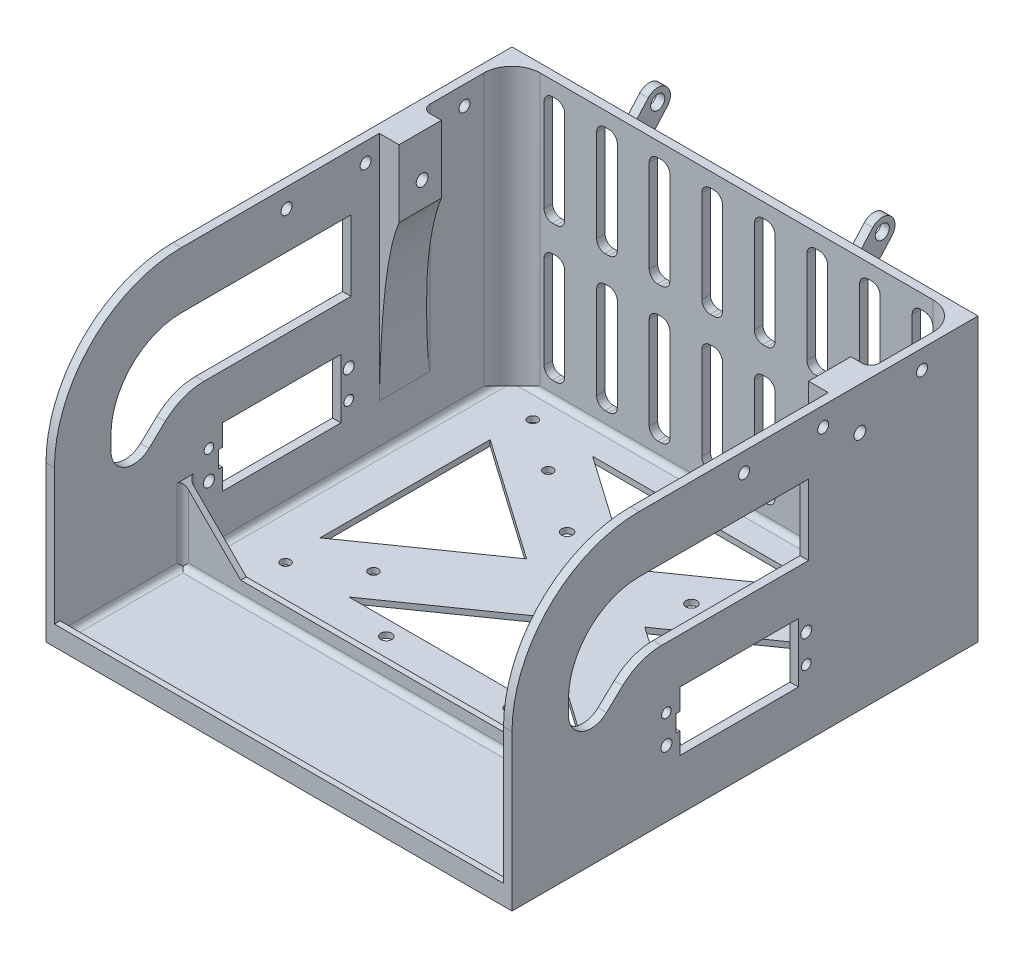
from build123d import *

# Parameters (mm, degrees)
BOSS_EXTRUDE1_DEPTH                = 165
SKETCH2_W                          = 159
SKETCH2_H                          = 167
CUT_EXTRUDE1_DEPTH                 = 98
SKETCH1_4_W                        = 15
SKETCH1_4_H                        = 100
SALIENTE_EXTRUIR1_DEPTH            = 10
SKETCH3_R                          = 2.5
BOSS_EXTRUDE2_DEPTH                = 1.5
REDONDEO3_R                        = 3
SKETCH4_R                          = 2.1
SKETCH4_W                          = 42
SKETCH4_H                          = 21
CUT_EXTRUDE2_DEPTH                 = 257.284558664
CORTAR_EXTRUIR8_REACH              = 256.363
CROQUIS13_W                        = 7.320857372
CROQUIS13_H                        = 38.747854906
REDONDEO6_R                        = 3
MATRIZL1_COUNT                     = 8
MATRIZL1_PITCH                     = 18.619938759
REDONDEO6_OF_MATRIZL1_R            = 3
MATRIZL2_DEPTH                     = 3
TALADRO_DE_MARGEN_PARA_M31_D       = 3.4
TALADRO_DE_MARGEN_PARA_M31_DEPTH   = 3
TALADRO_DE_MARGEN_PARA_M3_51_D     = 3.9
TALADRO_DE_MARGEN_PARA_M3_51_DEPTH = 3
CORTAR_EXTRUIR1_REACH              = 256.363
REDONDEO1_R                        = 20
CORTAR_EXTRUIR2_REACH              = 258.285
SKETCH4_4_W                        = 1.4
SKETCH4_4_H                        = 6
REDONDEO4_R                        = 3
REDONDEO1_OF_SIMETR_A2_R           = 20
REDONDEO5_R                        = 2
SALIENTE_EXTRUIR2_DEPTH            = 2
REDONDEO7_R                        = 2
REDONDEO7_OF_SIMETR_A10_R          = 2
CORTAR_EXTRUIR5_REACH              = 257.464
CROQUIS11_R                        = 1.95
CROQUIS15_W                        = 79.5
CROQUIS15_H                        = 5
SALIENTE_EXTRUIR3_DEPTH            = 2
REDONDEO8_R                        = 1
TALADRO_DE_MARGEN_PARA_M3_52_D     = 3.9
TALADRO_DE_MARGEN_PARA_M3_52_DEPTH = 3
CORTAR_EXTRUIR9_REACH              = 229.336
REDONDEO11_R                       = 10
CORTAR_EXTRUIR10_REACH             = 257.464
TALADRO_DE_MARGEN_PARA_M32_D       = 3.4
REDONDEO12_START                   = 6
REDONDEO12_DEPTH                   = 158


with BuildPart() as part:
    # Sketch1 → Boss-Extrude1 (new body)
    with BuildSketch(Plane(origin=(0, 0, 0), x_dir=(0, 0, -1), z_dir=(1, 0, 0))):
        with BuildLine():
            Line((0, 0), (-165, 0))
            Line((-165, 0), (-165, 55))
            ThreePointArc((-165, 55), (-151.819805153, 86.819805153), (-120, 100))
            Line((-120, 100), (0, 100))
            Line((0, 100), (0, 0))
        make_face()
    extrude(amount=BOSS_EXTRUDE1_DEPTH)

    # Sketch2 → Cut-Extrude1 (cut)
    with BuildSketch(Plane(origin=(0, 100, 0), x_dir=(1, 0, 0), z_dir=(0, 1, 0))):
        with Locations((82.5, -86.5)):
            Rectangle(SKETCH2_W, SKETCH2_H)
    extrude(amount=-CUT_EXTRUDE1_DEPTH, mode=Mode.SUBTRACT)

    # Sketch1<4> → Saliente-Extruir1 (add)
    with BuildSketch(Plane(origin=(0, 0, 0), x_dir=(0, 0, -1), z_dir=(1, 0, 0))):
        with Locations((-42.5, 50)):
            Rectangle(SKETCH1_4_W, SKETCH1_4_H)
    saliente_extruir1 = extrude(amount=SALIENTE_EXTRUIR1_DEPTH)

    # Sketch3 → Boss-Extrude2 (add, symmetric)
    with BuildSketch(Plane(origin=(122.25, 0, 0), x_dir=(0, 0, -1), z_dir=(1, 0, 0))):
        with BuildLine():
            Line((0, 100), (0, 86.483689179))
            Line((0, 86.483689179), (10.709846007, 98.483689179))
            ThreePointArc((10.709846007, 98.483689179), (10.348889249, 104.837405432), (3.995172996, 104.476448674))
            Line((3.995172996, 104.476448674), (0, 100))
        make_face()
        with Locations((7.352509502, 101.480068927)):
            Circle(SKETCH3_R, mode=Mode.SUBTRACT)
    boss_extrude2 = extrude(amount=BOSS_EXTRUDE2_DEPTH, both=True)

    # Mirror1: Boss-Extrude2 across plane
    add(boss_extrude2.mirror(Plane(origin=(82.5, 0, 0), x_dir=(0, 0, 1), z_dir=(1, 0, 0))))

    # Redondeo3
    redondeo3_edges = [part.edges().sort_by_distance(p)[0] for p in [
        (3, 51, 35),
    ]]
    fillet(redondeo3_edges, radius=REDONDEO3_R)

    # Simetría1: Saliente-Extruir1 across plane
    add(saliente_extruir1.mirror(Plane(origin=(82.5, 0, 0), x_dir=(0, 0, 1), z_dir=(1, 0, 0))))

    # Sketch4 → Cut-Extrude2 (cut, through all)
    with BuildSketch(Plane(origin=(165, 0, 0), x_dir=(0, 0, -1), z_dir=(1, 0, 0))):
        with Locations((-41.810728321, 85.063406284)):
            Circle(SKETCH4_R)
        with Locations((-84.561214212, 28.49486379)):
            Rectangle(SKETCH4_W, SKETCH4_H)
    extrude(amount=-CUT_EXTRUDE2_DEPTH, mode=Mode.SUBTRACT)

    # Croquis13 → Cortar-Extruir8 (cut, up to next)
    with BuildSketch(Plane.XY.offset(3), mode=Mode.PRIVATE) as cortar_extruir8_sk1:
        with Locations((18, 75.5)):
            Rectangle(CROQUIS13_W, CROQUIS13_H)
    cortar_extruir8_tool1 = extrude(cortar_extruir8_sk1.sketch, amount=-CORTAR_EXTRUIR8_REACH, mode=Mode.PRIVATE) & part.part
    cortar_extruir8 = cortar_extruir8_tool1.solids().sort_by_distance((18, 75.5, 3))[0]
    add(cortar_extruir8, mode=Mode.SUBTRACT)

    # Redondeo6
    redondeo6_edges = [part.edges().sort_by_distance(p)[0] for p in [
        (14.339571314, 56.126072547, 1.5),
        (14.339571314, 94.873927453, 1.5),
        (21.660428686, 94.873927453, 1.5),
        (21.660428686, 56.126072547, 1.5),
    ]]
    fillet(redondeo6_edges, radius=REDONDEO6_R)

    # MatrizL1: Cortar-Extruir8 ×8
    with Locations(*[(i * MATRIZL1_PITCH, 0, 0) for i in range(1, MATRIZL1_COUNT)]):
        add(cortar_extruir8, mode=Mode.SUBTRACT)

    # Redondeo6 of MatrizL1
    redondeo6_of_matrizl1_edges = [part.edges().sort_by_distance(p)[0] for p in [
        (32.959510073, 56.126072547, 1.5),
        (32.959510073, 94.873927453, 1.5),
        (40.280367445, 94.873927453, 1.5),
        (40.280367445, 56.126072547, 1.5),
        (51.579448833, 56.126072547, 1.5),
        (51.579448833, 94.873927453, 1.5),
        (58.900306204, 94.873927453, 1.5),
        (58.900306204, 56.126072547, 1.5),
        (70.199387592, 56.126072547, 1.5),
        (70.199387592, 94.873927453, 1.5),
        (77.520244963, 94.873927453, 1.5),
        (77.520244963, 56.126072547, 1.5),
        (88.819326351, 56.126072547, 1.5),
        (88.819326351, 94.873927453, 1.5),
        (96.140183722, 94.873927453, 1.5),
        (96.140183722, 56.126072547, 1.5),
        (107.43926511, 56.126072547, 1.5),
        (107.43926511, 94.873927453, 1.5),
        (114.760122482, 94.873927453, 1.5),
        (114.760122482, 56.126072547, 1.5),
        (126.059203869, 56.126072547, 1.5),
        (126.059203869, 94.873927453, 1.5),
        (133.380061241, 94.873927453, 1.5),
        (133.380061241, 56.126072547, 1.5),
        (144.679142629, 56.126072547, 1.5),
        (144.679142629, 94.873927453, 1.5),
        (152, 94.873927453, 1.5),
        (152, 56.126072547, 1.5),
    ]]
    fillet(redondeo6_of_matrizl1_edges, radius=REDONDEO6_OF_MATRIZL1_R)

    # MatrizL2: read off the stored shape, not the designer's step
    # MatrizL2 outline → MatrizL2 (cut)
    with BuildSketch(Plane.XY):
        with BuildLine():
            ThreePointArc((149, 8), (151.121320344, 8.878679656), (152, 11))
            Line((152, 11), (152, 43.747854905))
            ThreePointArc((152, 43.747854905), (151.121320344, 45.869175249), (149, 46.747854905))
            Line((149, 46.747854905), (147.679142629, 46.747854905))
            ThreePointArc((147.679142629, 46.747854905), (145.557822285, 45.869175249), (144.679142629, 43.747854905))
            Line((144.679142629, 43.747854905), (144.679142629, 11))
            ThreePointArc((144.679142629, 11), (145.557822285, 8.878679656), (147.679142629, 8))
            Line((147.679142629, 8), (149, 8))
        make_face()
        with BuildLine():
            ThreePointArc((130.380061241, 8), (132.501381584, 8.878679656), (133.380061241, 11))
            Line((133.380061241, 11), (133.380061241, 43.747854905))
            ThreePointArc((133.380061241, 43.747854905), (132.501381584, 45.869175248), (130.380061241, 46.747854905))
            Line((130.380061241, 46.747854905), (129.059203869, 46.747854905))
            ThreePointArc((129.059203869, 46.747854905), (126.937883525, 45.869175248), (126.059203869, 43.747854905))
            Line((126.059203869, 43.747854905), (126.059203869, 11))
            ThreePointArc((126.059203869, 11), (126.937883525, 8.878679657), (129.059203869, 8))
            Line((129.059203869, 8), (130.380061241, 8))
        make_face()
        with BuildLine():
            ThreePointArc((111.760122482, 8), (113.881442826, 8.878679657), (114.760122482, 11))
            Line((114.760122482, 11), (114.760122482, 43.747854905))
            ThreePointArc((114.760122482, 43.747854905), (113.881442826, 45.869175248), (111.760122482, 46.747854905))
            Line((111.760122482, 46.747854905), (110.43926511, 46.747854905))
            ThreePointArc((110.43926511, 46.747854905), (108.317944766, 45.869175248), (107.43926511, 43.747854905))
            Line((107.43926511, 43.747854905), (107.43926511, 11))
            ThreePointArc((107.43926511, 11), (108.317944766, 8.878679657), (110.43926511, 8))
            Line((110.43926511, 8), (111.760122482, 8))
        make_face()
        with BuildLine():
            ThreePointArc((93.140183722, 8), (95.261504066, 8.878679656), (96.140183722, 11))
            Line((96.140183722, 11), (96.140183722, 43.747854905))
            ThreePointArc((96.140183722, 43.747854905), (95.261504066, 45.869175249), (93.140183722, 46.747854905))
            Line((93.140183722, 46.747854905), (91.819326351, 46.747854905))
            ThreePointArc((91.819326351, 46.747854905), (89.698006007, 45.869175249), (88.819326351, 43.747854905))
            Line((88.819326351, 43.747854905), (88.819326351, 11))
            ThreePointArc((88.819326351, 11), (89.698006007, 8.878679656), (91.819326351, 8))
            Line((91.819326351, 8), (93.140183722, 8))
        make_face()
        with BuildLine():
            ThreePointArc((74.520244963, 8), (76.641565307, 8.878679656), (77.520244963, 11))
            Line((77.520244963, 11), (77.520244963, 43.747854905))
            ThreePointArc((77.520244963, 43.747854905), (76.641565307, 45.869175249), (74.520244963, 46.747854905))
            Line((74.520244963, 46.747854905), (73.199387592, 46.747854905))
            ThreePointArc((73.199387592, 46.747854905), (71.078067248, 45.869175249), (70.199387592, 43.747854905))
            Line((70.199387592, 43.747854905), (70.199387592, 11))
            ThreePointArc((70.199387592, 11), (71.078067248, 8.878679656), (73.199387592, 8))
            Line((73.199387592, 8), (74.520244963, 8))
        make_face()
        with BuildLine():
            ThreePointArc((55.900306204, 8), (58.021626548, 8.878679656), (58.900306204, 11))
            Line((58.900306204, 11), (58.900306204, 43.747854905))
            ThreePointArc((58.900306204, 43.747854905), (58.021626548, 45.869175249), (55.900306204, 46.747854905))
            Line((55.900306204, 46.747854905), (54.579448833, 46.747854905))
            ThreePointArc((54.579448833, 46.747854905), (52.458128489, 45.869175249), (51.579448833, 43.747854905))
            Line((51.579448833, 43.747854905), (51.579448833, 11))
            ThreePointArc((51.579448833, 11), (52.458128489, 8.878679656), (54.579448833, 8))
            Line((54.579448833, 8), (55.900306204, 8))
        make_face()
        with BuildLine():
            Line((14.339571314, 43.747854905), (14.339571314, 11))
            ThreePointArc((14.339571314, 11), (15.21825097, 8.878679656), (17.339571314, 8))
            Line((17.339571314, 8), (18.660428686, 8))
            ThreePointArc((18.660428686, 8), (20.781749029, 8.878679656), (21.660428686, 11))
            Line((21.660428686, 11), (21.660428686, 43.747854905))
            ThreePointArc((21.660428686, 43.747854905), (20.78174903, 45.869175248), (18.660428686, 46.747854905))
            Line((18.660428686, 46.747854905), (17.339571314, 46.747854905))
            ThreePointArc((17.339571314, 46.747854905), (15.21825097, 45.869175248), (14.339571314, 43.747854905))
        make_face()
        with BuildLine():
            Line((32.959510073, 43.747854905), (32.959510073, 11))
            ThreePointArc((32.959510073, 11), (33.83818973, 8.878679657), (35.959510073, 8))
            Line((35.959510073, 8), (37.280367445, 8))
            ThreePointArc((37.280367445, 8), (39.401687788, 8.878679657), (40.280367445, 11))
            Line((40.280367445, 11), (40.280367445, 43.747854905))
            ThreePointArc((40.280367445, 43.747854905), (39.401687789, 45.869175248), (37.280367445, 46.747854905))
            Line((37.280367445, 46.747854905), (35.959510073, 46.747854905))
            ThreePointArc((35.959510073, 46.747854905), (33.838189729, 45.869175248), (32.959510073, 43.747854905))
        make_face()
    extrude(amount=MATRIZL2_DEPTH, mode=Mode.SUBTRACT)

    # Taladro de margen para M31
    with Locations(Plane(origin=(165, 0, 0), x_dir=(0, 0, -1), z_dir=(1, 0, 0))):
        with Locations((-110.311214212, 33.49486379), (-60.811214212, 23.49486379)):
            taladro_de_margen_para_m31 = Hole(TALADRO_DE_MARGEN_PARA_M31_D / 2, depth=TALADRO_DE_MARGEN_PARA_M31_DEPTH)

    # Taladro de margen para M3.51
    with Locations(Plane(origin=(165, 0, 0), x_dir=(0, 0, -1), z_dir=(1, 0, 0))):
        with Locations((-110.311214212, 23.49486379), (-60.811214212, 33.49486379)):
            taladro_de_margen_para_m3_51 = Hole(TALADRO_DE_MARGEN_PARA_M3_51_D / 2, depth=TALADRO_DE_MARGEN_PARA_M3_51_DEPTH)

    # Croquis5 → Cortar-Extruir1 (cut, up to next)
    with BuildSketch(Plane.ZY.offset(-162), mode=Mode.PRIVATE) as cortar_extruir1_sk1:
        with BuildLine():
            Line((145, 55), (145, 50))
            ThreePointArc((145, 50), (140.1754321, 42.657205506), (131.520842255, 44.170863666))
            Line((131.520842255, 44.170863666), (120, 55))
            Line((120, 55), (60, 55))
            Line((60, 55), (60, 80))
            Line((60, 80), (120, 80))
            ThreePointArc((120, 80), (137.67766953, 72.67766953), (145, 55))
        make_face()
    cortar_extruir1_tool1 = extrude(cortar_extruir1_sk1.sketch, amount=-CORTAR_EXTRUIR1_REACH, mode=Mode.PRIVATE) & part.part
    cortar_extruir1 = cortar_extruir1_tool1.solids().sort_by_distance((162, 65.309322, 103.50114))[0]
    add(cortar_extruir1, mode=Mode.SUBTRACT)

    # Redondeo1
    redondeo1_edges = [part.edges().sort_by_distance(p)[0] for p in [
        (163.5, 55, 120),
    ]]
    fillet(redondeo1_edges, radius=REDONDEO1_R)

    # Sketch4<4> → Cortar-Extruir2 (cut, up to next)
    with BuildSketch(Plane(origin=(165, 0, 0), x_dir=(0, 0, -1), z_dir=(1, 0, 0)), mode=Mode.PRIVATE) as cortar_extruir2_sk1:
        with Locations((-106.261214212, 28.49486379)):
            Rectangle(SKETCH4_4_W, SKETCH4_4_H)
    cortar_extruir2_tool1 = extrude(cortar_extruir2_sk1.sketch, amount=-CORTAR_EXTRUIR2_REACH, mode=Mode.PRIVATE) & part.part
    cortar_extruir2 = cortar_extruir2_tool1.solids().sort_by_distance((165, 28.494864, 106.261214))[0]
    add(cortar_extruir2, mode=Mode.SUBTRACT)

    # Redondeo4
    redondeo4_edges = [part.edges().sort_by_distance(p)[0] for p in [
        (162, 51, 35),
    ]]
    fillet(redondeo4_edges, radius=REDONDEO4_R)

    # Simetría2: Taladro de margen para M31, Taladro de margen para M3.51, Cortar-Extruir1, Cortar-Extruir2 across plane
    add(taladro_de_margen_para_m31.mirror(Plane(origin=(82.5, 0, 0), x_dir=(0, 0, 1), z_dir=(1, 0, 0))), mode=Mode.SUBTRACT)
    add(taladro_de_margen_para_m3_51.mirror(Plane(origin=(82.5, 0, 0), x_dir=(0, 0, 1), z_dir=(1, 0, 0))), mode=Mode.SUBTRACT)
    add(cortar_extruir1.mirror(Plane(origin=(82.5, 0, 0), x_dir=(0, 0, 1), z_dir=(1, 0, 0))), mode=Mode.SUBTRACT)
    add(cortar_extruir2.mirror(Plane(origin=(82.5, 0, 0), x_dir=(0, 0, 1), z_dir=(1, 0, 0))), mode=Mode.SUBTRACT)

    # Redondeo1 of Simetría2
    redondeo1_of_simetr_a2_edges = [part.edges().sort_by_distance(p)[0] for p in [
        (1.5, 55, 120),
    ]]
    fillet(redondeo1_of_simetr_a2_edges, radius=REDONDEO1_OF_SIMETR_A2_R)

    # Redondeo5
    redondeo5_edges = [part.edges().sort_by_distance(p)[0] for p in [
        (82.5, 2, 3),
    ]]
    fillet(redondeo5_edges, radius=REDONDEO5_R)

    # Croquis14 → Saliente-Extruir2 (add)
    with BuildSketch(Plane(origin=(0, 0, 119.561214212), x_dir=(-1, 0, 0), z_dir=(0, 0, -1))):
        Polygon((-162, 28.492957283), (-141.507042717, 8), (-82.5, 8), (-82.5, 2), (-162, 2), align=None)
    saliente_extruir2 = extrude(amount=SALIENTE_EXTRUIR2_DEPTH)

    # Redondeo7
    redondeo7_edges = [part.edges().sort_by_distance(p)[0] for p in [
        (162, 15.246478641, 119.561214212),
        (122.25, 2, 119.561214212),
        (162, 15.246478641, 117.561214212),
    ]]
    fillet(redondeo7_edges, radius=REDONDEO7_R)

    # Simetría10: Saliente-Extruir2 across plane
    add(saliente_extruir2.mirror(Plane(origin=(82.5, 0, 0), x_dir=(0, 0, 1), z_dir=(1, 0, 0))))

    # Redondeo7 of Simetría10
    redondeo7_of_simetr_a10_edges = [part.edges().sort_by_distance(p)[0] for p in [
        (3, 15.246478641, 119.561214212),
        (42.75, 2, 119.561214212),
        (3, 15.246478641, 117.561214212),
    ]]
    fillet(redondeo7_of_simetr_a10_edges, radius=REDONDEO7_OF_SIMETR_A10_R)

    # Croquis11 → Cortar-Extruir5 (cut, up to next)
    with BuildSketch(Plane(origin=(0, 2, 0), x_dir=(1, 0, 0), z_dir=(0, 1, 0)), mode=Mode.PRIVATE) as cortar_extruir5_sk1:
        with Locations(Location((104.5, -41, 0), (0, 0, 270))):
            Circle(CROQUIS11_R)
    cortar_extruir5_tool1 = extrude(cortar_extruir5_sk1.sketch, amount=-CORTAR_EXTRUIR5_REACH, mode=Mode.PRIVATE) & part.part
    # Croquis11 → Cortar-Extruir5 (cut, up to next)
    with BuildSketch(Plane(origin=(0, 2, 0), x_dir=(1, 0, 0), z_dir=(0, 1, 0)), mode=Mode.PRIVATE) as cortar_extruir5_sk2:
        with Locations(Location((60.5, -41, 0), (0, 0, 90))):
            Circle(CROQUIS11_R)
    cortar_extruir5_tool2 = extrude(cortar_extruir5_sk2.sketch, amount=-CORTAR_EXTRUIR5_REACH, mode=Mode.PRIVATE) & part.part
    # Croquis11 → Cortar-Extruir5 (cut, up to next)
    with BuildSketch(Plane(origin=(0, 2, 0), x_dir=(1, 0, 0), z_dir=(0, 1, 0)), mode=Mode.PRIVATE) as cortar_extruir5_sk3:
        with Locations(Location((104.5, -105, 0), (0, 0, 90))):
            Circle(CROQUIS11_R)
    cortar_extruir5_tool3 = extrude(cortar_extruir5_sk3.sketch, amount=-CORTAR_EXTRUIR5_REACH, mode=Mode.PRIVATE) & part.part
    # Croquis11 → Cortar-Extruir5 (cut, up to next)
    with BuildSketch(Plane(origin=(0, 2, 0), x_dir=(1, 0, 0), z_dir=(0, 1, 0)), mode=Mode.PRIVATE) as cortar_extruir5_sk4:
        with Locations(Location((60.5, -105, 0), (0, 0, 270))):
            Circle(CROQUIS11_R)
    cortar_extruir5_tool4 = extrude(cortar_extruir5_sk4.sketch, amount=-CORTAR_EXTRUIR5_REACH, mode=Mode.PRIVATE) & part.part
    add(cortar_extruir5_tool1.solids().sort_by_distance((104.5, 2, 41))[0], mode=Mode.SUBTRACT)
    add(cortar_extruir5_tool2.solids().sort_by_distance((60.5, 2, 41))[0], mode=Mode.SUBTRACT)
    add(cortar_extruir5_tool3.solids().sort_by_distance((104.5, 2, 105))[0], mode=Mode.SUBTRACT)
    add(cortar_extruir5_tool4.solids().sort_by_distance((60.5, 2, 105))[0], mode=Mode.SUBTRACT)

    # Croquis15 → Saliente-Extruir3 (add)
    with BuildSketch(Plane.XY.offset(165)):
        with Locations((122.25, 4.5)):
            Rectangle(CROQUIS15_W, CROQUIS15_H)
    saliente_extruir3 = extrude(amount=-SALIENTE_EXTRUIR3_DEPTH)

    # Simetría11: Saliente-Extruir3 across plane
    add(saliente_extruir3.mirror(Plane(origin=(82.5, 0, 0), x_dir=(0, 0, 1), z_dir=(1, 0, 0))))

    # Redondeo8
    redondeo8_edges = [part.edges().sort_by_distance(p)[0] for p in [
        (82.5, 2, 163),
    ]]
    fillet(redondeo8_edges, radius=REDONDEO8_R)

    # Taladro de margen para M3.52
    with Locations(Plane(origin=(165, 0, 0), x_dir=(0, 0, -1), z_dir=(1, 0, 0))):
        with Locations((-19.8121066, 93.28083821), (-54.8121066, 93.28083821), (-82.8121066, 93.28083821)):
            taladro_de_margen_para_m3_52 = Hole(TALADRO_DE_MARGEN_PARA_M3_52_D / 2, depth=TALADRO_DE_MARGEN_PARA_M3_52_DEPTH)

    # Simetría12: Taladro de margen para M3.52 across plane
    add(taladro_de_margen_para_m3_52.mirror(Plane(origin=(82.5, 0, 0), x_dir=(0, 0, 1), z_dir=(1, 0, 0))), mode=Mode.SUBTRACT)

    # Croquis21 → Cortar-Extruir9 (cut, up to next)
    with BuildSketch(Plane.XY.offset(50), mode=Mode.PRIVATE) as cortar_extruir9_sk1:
        with BuildLine():
            Line((10, 76.105314592), (10, 2))
            Line((10, 2), (3, 2))
            Line((3, 2), (3, 17.949474499))
            add(Edge.make_bspline(
                [(3, 17.949474499), (3.890851969, 61.853840315), (10, 76.105314592)],
                knots=[0, 0, 0, 1, 1, 1], degree=2))
        make_face()
    cortar_extruir9_tool1 = extrude(cortar_extruir9_sk1.sketch, amount=-CORTAR_EXTRUIR9_REACH, mode=Mode.PRIVATE) & part.part
    cortar_extruir9 = cortar_extruir9_tool1.solids().sort_by_distance((6.982117, 32.397976, 50))[0]
    add(cortar_extruir9, mode=Mode.SUBTRACT)

    # Simetría13: Cortar-Extruir9 across plane
    add(cortar_extruir9.mirror(Plane(origin=(82.5, 0, 0), x_dir=(0, 0, 1), z_dir=(1, 0, 0))), mode=Mode.SUBTRACT)

    # Redondeo11
    # the kernel refuses this fillet: 10 mm, written as the material it adds along each edge
    with BuildSketch(Plane(origin=(3, 100, 3), x_dir=(1, 0, 0), z_dir=(0, -1, 0))) as redondeo11_piece_1_section:
        with BuildLine():
            CenterArc((REDONDEO11_R, REDONDEO11_R), REDONDEO11_R, 180, 90)
            Line((0, REDONDEO11_R), (0, 0))
            Line((0, 0), (REDONDEO11_R, 0))
        make_face()
    redondeo11_piece_1 = extrude(amount=121, mode=Mode.PRIVATE)
    redondeo11_piece_1 = split(redondeo11_piece_1, bisect_by=Plane(origin=(3, 0, 3), z_dir=(0, 1, 0)), keep=Keep.TOP, mode=Mode.PRIVATE)
    add(redondeo11_piece_1)
    with BuildSketch(Plane(origin=(162, 100, 3), x_dir=(-1, 0, 0), z_dir=(0, -1, 0))) as redondeo11_piece_2_section:
        with BuildLine():
            CenterArc((REDONDEO11_R, -REDONDEO11_R), REDONDEO11_R, 90, 90)
            Line((0, -REDONDEO11_R), (0, 0))
            Line((0, 0), (REDONDEO11_R, 0))
        make_face()
    redondeo11_piece_2 = extrude(amount=121, mode=Mode.PRIVATE)
    redondeo11_piece_2 = split(redondeo11_piece_2, bisect_by=Plane(origin=(162, 0, 3), z_dir=(0, 1, 0)), keep=Keep.TOP, mode=Mode.PRIVATE)
    add(redondeo11_piece_2)

    # Croquis22 → Cortar-Extruir10 (cut, up to next)
    with BuildSketch(Plane(origin=(0, 2, 0), x_dir=(1, 0, 0), z_dir=(0, 1, 0)), mode=Mode.PRIVATE) as cortar_extruir10_sk1:
        Polygon((41.813105711, -13.266000688), (123.186894289, -13.266000688), (82.5, -41.755270775), align=None)
    cortar_extruir10_tool1 = extrude(cortar_extruir10_sk1.sketch, amount=-CORTAR_EXTRUIR10_REACH, mode=Mode.PRIVATE) & part.part
    # Croquis22 → Cortar-Extruir10 (cut, up to next)
    with BuildSketch(Plane(origin=(0, 2, 0), x_dir=(1, 0, 0), z_dir=(0, 1, 0)), mode=Mode.PRIVATE) as cortar_extruir10_sk2:
        Polygon((18.556474378, -26.280122246), (18.556474378, -86.529009435), (61.578638453, -56.404565841), align=None)
    cortar_extruir10_tool2 = extrude(cortar_extruir10_sk2.sketch, amount=-CORTAR_EXTRUIR10_REACH, mode=Mode.PRIVATE) & part.part
    # Croquis22 → Cortar-Extruir10 (cut, up to next)
    with BuildSketch(Plane(origin=(0, 2, 0), x_dir=(1, 0, 0), z_dir=(0, 1, 0)), mode=Mode.PRIVATE) as cortar_extruir10_sk3:
        Polygon((82.5, -71.053860906), (41.813105711, -99.543130993), (123.186894289, -99.543130993), align=None)
    cortar_extruir10_tool3 = extrude(cortar_extruir10_sk3.sketch, amount=-CORTAR_EXTRUIR10_REACH, mode=Mode.PRIVATE) & part.part
    # Croquis22 → Cortar-Extruir10 (cut, up to next)
    with BuildSketch(Plane(origin=(0, 2, 0), x_dir=(1, 0, 0), z_dir=(0, 1, 0)), mode=Mode.PRIVATE) as cortar_extruir10_sk4:
        Polygon((103.421361547, -56.404565841), (146.443525622, -26.280122246), (146.443525622, -86.529009435), align=None)
    cortar_extruir10_tool4 = extrude(cortar_extruir10_sk4.sketch, amount=-CORTAR_EXTRUIR10_REACH, mode=Mode.PRIVATE) & part.part
    add(cortar_extruir10_tool1.solids().sort_by_distance((82.5, 2, 22.762424))[0], mode=Mode.SUBTRACT)
    add(cortar_extruir10_tool2.solids().sort_by_distance((32.897196, 2, 56.404566))[0], mode=Mode.SUBTRACT)
    add(cortar_extruir10_tool3.solids().sort_by_distance((82.5, 2, 90.046708))[0], mode=Mode.SUBTRACT)
    add(cortar_extruir10_tool4.solids().sort_by_distance((132.102804, 2, 56.404566))[0], mode=Mode.SUBTRACT)

    # Taladro de margen para M32 (through all)
    with Locations(Plane(origin=(0, 2, 0), x_dir=(1, 0, 0), z_dir=(0, 1, 0))):
        with Locations((38.29669674, -25.453079685), (145, -100.167536979), (20, -100.167536979), (20, -12.641594703), (145, -12.641594703), (38.29669674, -87.356051997), (126.70330326, -87.356051997), (126.70330326, -25.453079685)):
            Hole(TALADRO_DE_MARGEN_PARA_M32_D / 2)

    # Redondeo12: read off the stored shape, not the designer's step
    # Redondeo12 outline → Redondeo12 (add)
    with BuildSketch(Plane.XY.offset(REDONDEO12_START)):
        with BuildLine():
            Line((3, 2), (5, 2))
            ThreePointArc((5, 2), (3.585786438, 2.585786438), (3, 4))
            Line((3, 4), (3, 2))
        make_face()
        with BuildLine():
            ThreePointArc((162, 4), (161.414213562, 2.585786438), (160, 2))
            Line((160, 2), (162, 2))
            Line((162, 2), (162, 4))
        make_face()
    extrude(amount=REDONDEO12_DEPTH)


solid = part.part
